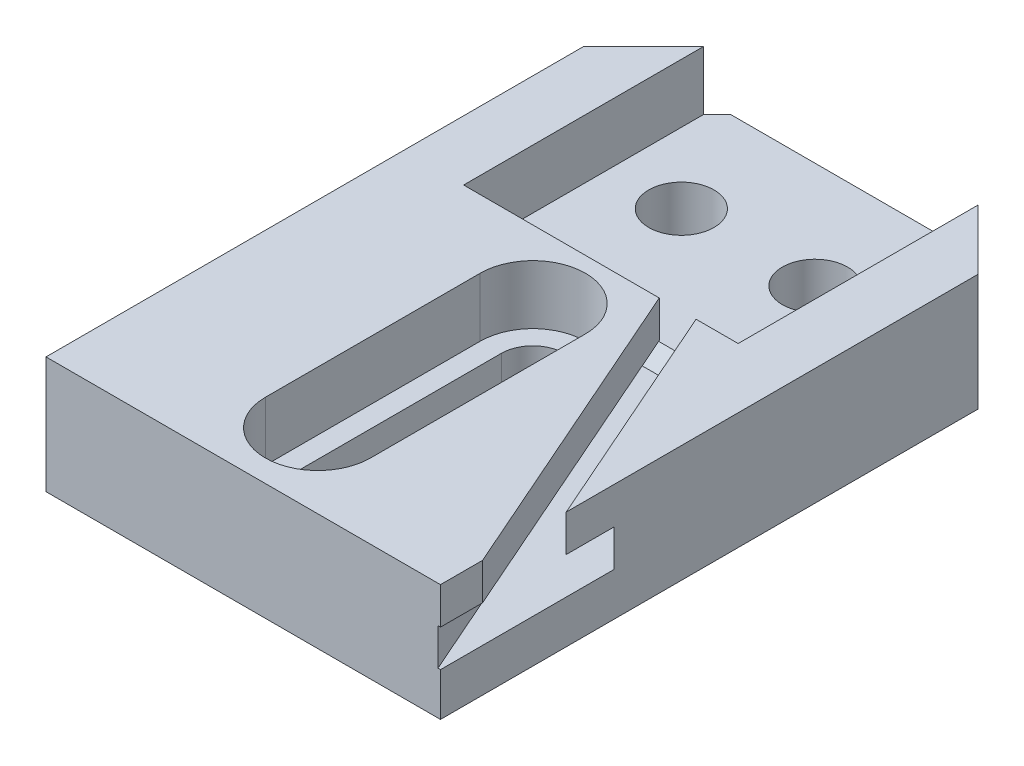
from build123d import *

# Parameters (mm, degrees)
SKETCH1_W                                  = 18.75
SKETCH1_H                                  = 29.05
BOSS_EXTRUDE1_DEPTH                        = 5.55
MICROSWITCHCUTSKETCH2_W                    = 13.05
MICROSWITCHCUTSKETCH2_H                    = 12.05
MICROSWITCHCUT_EXTRUDE1_DEPTH              = 2.8
MICROSWITCHMOUNTINGHOLESSKETCH3_R          = 1.55
MICROSWITCHMOUNTINGHOLESCUT_EXTRUDE2_DEPTH = 3.1
SLIDINGMOUNTHOLECUT_EXTRUDE3_DEPTH         = 36.018102461
CHAMFER1_SIZE                              = 3.5
SLIDINGMOUNTHOLEBORECUT_EXTRUDE4_DEPTH     = 2.8
THINCABLECUT_EXTRUDE5_DEPTH                = 1.75
THICKCABLECUT_EXTRUDE6_DEPTH               = 1.75
CHAMFER2_SIZE                              = 1


with BuildPart() as part:
    # Sketch1 → Boss-Extrude1 (new body)
    with BuildSketch(Plane(origin=(0, 0, 0), x_dir=(1, 0, 0), z_dir=(0, 1, 0))):
        with Locations((9.375, 14.525)):
            Rectangle(SKETCH1_W, SKETCH1_H)
    extrude(amount=BOSS_EXTRUDE1_DEPTH)

    # MicroSwitchCutSketch2 → MicroSwitchCut-Extrude1 (cut)
    with BuildSketch(Plane(origin=(0, 5.55, 0), x_dir=(1, 0, 0), z_dir=(0, 1, 0))):
        with Locations((9.375, 23.025)):
            Rectangle(MICROSWITCHCUTSKETCH2_W, MICROSWITCHCUTSKETCH2_H)
    extrude(amount=-MICROSWITCHCUT_EXTRUDE1_DEPTH, mode=Mode.SUBTRACT)

    # MicroSwitchMountingHolesSketch3 → MicroSwitchMountingHolesCut-Extrude2 (cut)
    with BuildSketch(Plane(origin=(0, 2.75, 0), x_dir=(1, 0, 0), z_dir=(0, 1, 0))):
        with Locations(Location((6.2, 24, 0), (0, 0, 270))):
            Circle(MICROSWITCHMOUNTINGHOLESSKETCH3_R)
        with Locations(Location((12.55, 24, 0), (0, 0, 270))):
            Circle(MICROSWITCHMOUNTINGHOLESSKETCH3_R)
    extrude(amount=-MICROSWITCHMOUNTINGHOLESCUT_EXTRUDE2_DEPTH, mode=Mode.SUBTRACT)

    # GantryMountSlotSketch4 → SlidingMountHoleCut-Extrude3 (cut, through all)
    with BuildSketch(Plane(origin=(0, 5.55, 0), x_dir=(1, 0, 0), z_dir=(0, 1, 0))):
        with BuildLine():
            Line((10.875, 13.765586377), (10.875, 3.550728623))
            ThreePointArc((10.875, 3.550728623), (9.375, 2.050728623), (7.875, 3.550728623))
            Line((7.875, 3.550728623), (7.875, 13.765586377))
            ThreePointArc((7.875, 13.765586377), (9.375, 15.265586377), (10.875, 13.765586377))
        make_face()
    extrude(amount=-SLIDINGMOUNTHOLECUT_EXTRUDE3_DEPTH, mode=Mode.SUBTRACT)

    # Chamfer1
    chamfer1_edges = [part.edges().sort_by_distance(p)[0] for p in [
        (18.75, 2.775, -29.05),
        (0, 2.775, -29.05),
    ]]
    chamfer(chamfer1_edges, length=CHAMFER1_SIZE)

    # Sketch2 → SlidingMountHoleBoreCut-Extrude4 (cut)
    with BuildSketch(Plane(origin=(0, 5.55, 0), x_dir=(1, 0, 0), z_dir=(0, 1, 0))):
        with BuildLine():
            Line((6.875, 3.550728623), (6.875, 13.765586377))
            ThreePointArc((6.875, 13.765586377), (9.375, 16.265586377), (11.875, 13.765586377))
            Line((11.875, 13.765586377), (11.875, 3.550728623))
            ThreePointArc((11.875, 3.550728623), (9.375, 1.050728623), (6.875, 3.550728623))
        make_face()
    extrude(amount=-SLIDINGMOUNTHOLEBORECUT_EXTRUDE4_DEPTH, mode=Mode.SUBTRACT)

    # Sketch3 → ThinCableCut-Extrude5 (cut)
    with BuildSketch(Plane(origin=(0, 5.55, 0), x_dir=(1, 0, 0), z_dir=(0, 1, 0))):
        Polygon((12.15, 17), (18.75, 2), (18.75, 5.977272727), (13.9, 17), align=None)
    extrude(amount=-THINCABLECUT_EXTRUDE5_DEPTH, mode=Mode.SUBTRACT)

    # Sketch4 → ThickCableCut-Extrude6 (cut)
    with BuildSketch(Plane(origin=(0, 3.8, 0), x_dir=(1, 0, 0), z_dir=(0, 1, 0))):
        Polygon((11.15, 17), (18.75, -0.272727273), (18.75, 8.25), (14.9, 17), align=None)
    extrude(amount=-THICKCABLECUT_EXTRUDE6_DEPTH, mode=Mode.SUBTRACT)

    # Chamfer2
    # the kernel refuses this chamfer: 1 mm, written as the material it takes off along each edge
    with BuildSketch(Plane(origin=(17.471682988, 2.75, -17), x_dir=(0, 0.02749587661058651, -0.9996219169112968), z_dir=(-1, 0, 0))) as chamfer2_piece_1_section:
        Polygon((CHAMFER2_SIZE * 0.999621916911, CHAMFER2_SIZE * 0.0274958766106), (-CHAMFER2_SIZE * 0.0274958766106, CHAMFER2_SIZE * 0.999621916911), (0, 0), align=None)
    chamfer2_piece_1 = extrude(amount=8.893365976, mode=Mode.PRIVATE)
    chamfer2_piece_1 = split(chamfer2_piece_1, bisect_by=Plane(origin=(12.868179487, 2.05, -17.356410256), z_dir=(0, 1, 0)), keep=Keep.TOP, mode=Mode.PRIVATE)
    chamfer2_piece_1 = split(chamfer2_piece_1, bisect_by=Plane(origin=(11.297301471, 2.462820513, -16.665223929), z_dir=(0.9153150324227658, 0, -0.40273861426601665)), keep=Keep.TOP, mode=Mode.PRIVATE)
    chamfer2_piece_1 = split(chamfer2_piece_1, bisect_by=Plane(origin=(14.439057503, 2.462820513, -18.047596583), z_dir=(-0.9153150324227658, 0, 0.40273861426601687)), keep=Keep.TOP, mode=Mode.PRIVATE)
    add(chamfer2_piece_1, mode=Mode.SUBTRACT)


solid = part.part
